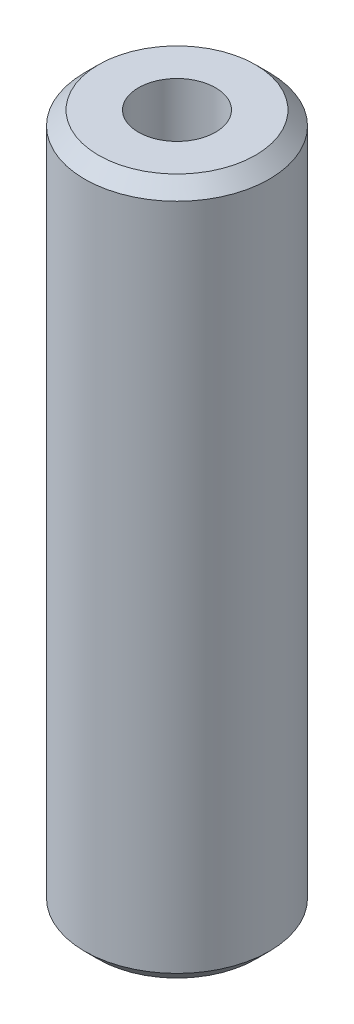
from build123d import *

# Parameters (mm, degrees)
SKETCH1_R           = 30
BOSS_EXTRUDE1_DEPTH = 226.332338019
SKETCH2_R           = 12.535742328
CUT_EXTRUDE1_DEPTH  = 231.274460662
CHAMFER1_SIZE       = 4.490934052


with BuildPart() as part:
    # Sketch1 → Boss-Extrude1 (new body)
    with BuildSketch(Plane(origin=(0, 0, 0), x_dir=(1, 0, 0), z_dir=(0, 1, 0))):
        Circle(SKETCH1_R)
    extrude(amount=BOSS_EXTRUDE1_DEPTH)

    # Sketch2 → Cut-Extrude1 (cut, through all)
    with BuildSketch(Plane(origin=(0, 0, 0), x_dir=(1, 0, 0), z_dir=(0, 1, 0))):
        Circle(SKETCH2_R)
    extrude(amount=CUT_EXTRUDE1_DEPTH, mode=Mode.SUBTRACT)

    # Chamfer1
    chamfer1_edges = [part.edges().sort_by_distance(p)[0] for p in [
        (-30, 226.332338019, 0),
        (-30, 0, 0),
    ]]
    chamfer(chamfer1_edges, length=CHAMFER1_SIZE)


solid = part.part
